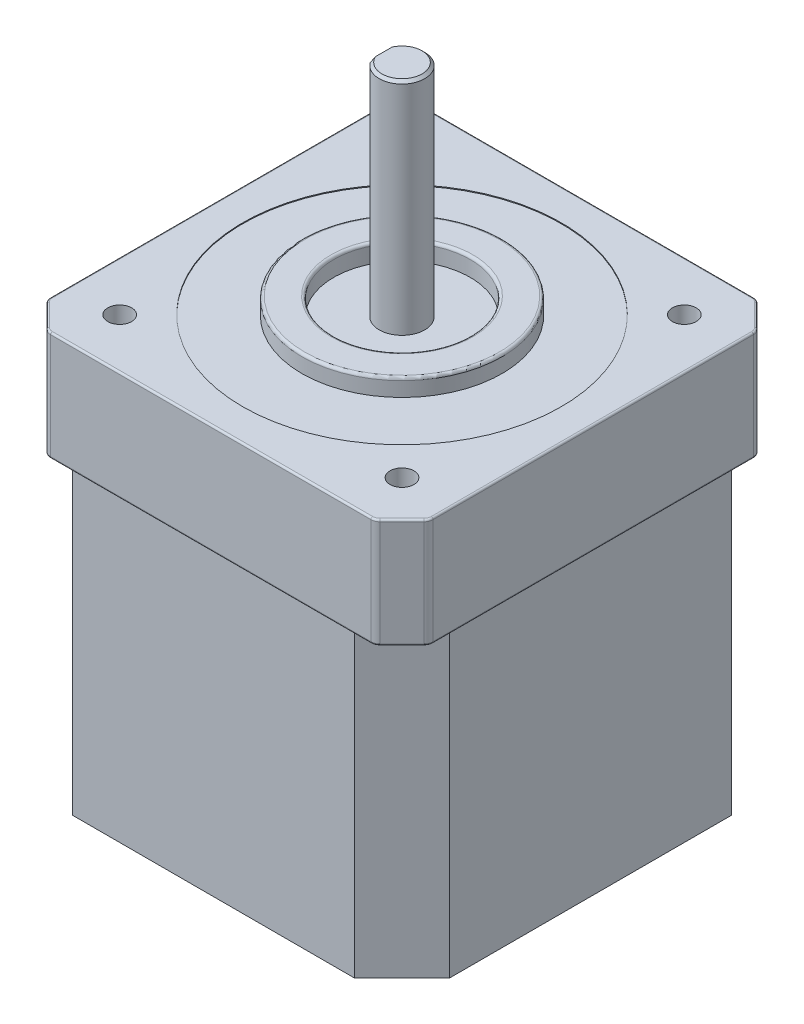
from build123d import *

# Parameters (mm, degrees)
SKETCH_1_W               = 42
SKETCH_1_H               = 42
EXTRUDE_1_DEPTH          = 60
CHAMFER_3_SIZE           = 3
SKETCH_2_R               = 11
EXTRUDE_2_DEPTH          = 1.8
SKETCH_3_R               = 2.5
EXTRUDE_3_DEPTH          = 24
SKETCH_4_OUTSIDE_W       = 64.576
SKETCH_4_OUTSIDE_H       = 64.576
CUT_EXTRUDE_1_DEPTH      = 36
FILLET_2_R               = 1
FILLET_3_R               = 0.2
CUT_EXTRUDE_START        = -15
CUT_EXTRUDE_5_DEPTH      = 15
CHAMFER_5_SIZE           = 0.3
CHAMFER_4_SIZE           = 0.5
SKETCH_6_R               = 1.3105
CUT_EXTRUDE_2_DEPTH      = 4.5
CUT_EXTRUDE_START_2      = -2
SKETCH_7_R               = 7.5
SKETCH_7_R_2             = 2.5
CUT_EXTRUDE_3_DEPTH      = 2
SKETCH_8_R               = 4.125
EXTRUDE_5_DEPTH          = 1.2
SKETCH_9_R               = 2.25
SKETCH_9_R_2             = 2.05
EXTRUDE_6_DEPTH          = 15.4
SKETCH_10_R              = 0.65
EXTRUDE_8_DEPTH          = 15.4
CUT_EXTRUDE_START_3      = -0.1
SKETCH_15_R              = 17.5
SKETCH_15_R_2            = 11
CUT_EXTRUDE_6_DEPTH      = 0.1
FILLET_4_R               = 0.3
PATTERN_CIRCULAR_3_COUNT = 4
SKETCH_20_W              = 88.292571494
SKETCH_20_H              = 79.893843274
CUT_EXTRUDE_13_DEPTH     = 15


with BuildPart() as part:
    # 草图1 → 凸台-拉伸1 (new body)
    with BuildSketch(Plane(origin=(0, 0, 0), x_dir=(1, 0, 0), z_dir=(0, 1, 0))):
        Rectangle(SKETCH_1_W, SKETCH_1_H)
    extrude(amount=EXTRUDE_1_DEPTH)

    # 倒角3
    chamfer_3_edges = [part.edges().sort_by_distance(p)[0] for p in [
        (-21, 30, -21),
        (21, 30, -21),
        (21, 30, 21),
        (-21, 30, 21),
    ]]
    chamfer(chamfer_3_edges, length=CHAMFER_3_SIZE)

    # 草图2 → 凸台-拉伸2 (add)
    with BuildSketch(Plane(origin=(0, 60, 0), x_dir=(1, 0, 0), z_dir=(0, 1, 0))):
        with Locations(Location((0, 0, 0), (0, 0, 270))):
            Circle(SKETCH_2_R)
    extrude(amount=EXTRUDE_2_DEPTH)

    # 草图3 → 凸台-拉伸3 (add)
    with BuildSketch(Plane(origin=(0, 60, 0), x_dir=(1, 0, 0), z_dir=(0, 1, 0))):
        with Locations(Location((0, 0, 0), (0, 0, 270))):
            Circle(SKETCH_3_R)
    extrude(amount=EXTRUDE_3_DEPTH)

    # 草图4 outside → 切除-拉伸1 (cut)
    with BuildSketch(Plane.XZ.offset(-12)):
        Rectangle(SKETCH_4_OUTSIDE_W, SKETCH_4_OUTSIDE_H)
        Polygon((15.471572875, 20.7), (-15.471572875, 20.7), (-20.7, 15.471572875), (-20.7, -15.471572875), (-15.471572875, -20.7), (15.471572875, -20.7), (20.7, -15.471572875), (20.7, 15.471572875), align=None, mode=Mode.SUBTRACT)
    extrude(amount=-CUT_EXTRUDE_1_DEPTH, mode=Mode.SUBTRACT)

    # 圆角2
    fillet_2_edges = [part.edges().sort_by_distance(p)[0] for p in [
        (-18, 6, -21),
        (18, 54, -21),
        (21, 54, 18),
        (21, 6, -18),
        (-18, 54, 21),
        (18, 6, 21),
        (-21, 54, -18),
        (-21, 6, 18),
        (-18, 54, -21),
        (-21, 6, -18),
        (-21, 54, 18),
        (-18, 6, 21),
        (18, 54, 21),
        (21, 6, 18),
        (21, 54, -18),
        (18, 6, -21),
    ]]
    fillet(fillet_2_edges, radius=FILLET_2_R)

    # 圆角3
    fillet_3_edges = [part.edges().sort_by_distance(p)[0] for p in [
        (21, 12, 0),
        (21, 0, 0),
        (0, 0, -21),
        (19.5, 0, -19.5),
        (19.5, 0, 19.5),
        (0, 0, 21),
        (-19.5, 0, 19.5),
        (-21, 0, 0),
        (-19.5, 0, -19.5),
        (-20.923879533, 0, -17.96846987),
        (-17.96846987, 0, -20.923879533),
        (17.96846987, 0, -20.923879533),
        (20.923879533, 0, -17.96846987),
        (-20.923879533, 0, 17.96846987),
        (-17.96846987, 0, 20.923879533),
        (17.96846987, 0, 20.923879533),
        (20.923879533, 0, 17.96846987),
        (19.5, 12, 19.5),
        (19.5, 12, -19.5),
        (0, 12, -21),
        (-19.5, 12, -19.5),
        (-21, 12, 0),
        (-19.5, 12, 19.5),
        (0, 12, 21),
        (-20.923879533, 12, -17.96846987),
        (-17.96846987, 12, -20.923879533),
        (17.96846987, 12, -20.923879533),
        (20.923879533, 12, -17.96846987),
        (-20.923879533, 12, 17.96846987),
        (-17.96846987, 12, 20.923879533),
        (17.96846987, 12, 20.923879533),
        (20.923879533, 12, 17.96846987),
        (0, 48, -21),
        (0, 60, -21),
        (21, 60, 0),
        (19.5, 60, -19.5),
        (-19.5, 60, -19.5),
        (-21, 60, 0),
        (-19.5, 60, 19.5),
        (0, 60, 21),
        (19.5, 60, 19.5),
        (-20.923879533, 60, 17.96846987),
        (-17.96846987, 60, 20.923879533),
        (17.96846987, 60, 20.923879533),
        (20.923879533, 60, 17.96846987),
        (17.96846987, 60, -20.923879533),
        (20.923879533, 60, -17.96846987),
        (-20.923879533, 60, -17.96846987),
        (-17.96846987, 60, -20.923879533),
        (-19.5, 48, -19.5),
        (0, 48, 21),
        (-19.5, 48, 19.5),
        (-21, 48, 0),
        (19.5, 48, -19.5),
        (21, 48, 0),
        (19.5, 48, 19.5),
        (-20.923879533, 48, 17.96846987),
        (-17.96846987, 48, 20.923879533),
        (17.96846987, 48, 20.923879533),
        (20.923879533, 48, 17.96846987),
        (17.96846987, 48, -20.923879533),
        (20.923879533, 48, -17.96846987),
        (-20.923879533, 48, -17.96846987),
        (-17.96846987, 48, -20.923879533),
    ]]
    fillet(fillet_3_edges, radius=FILLET_3_R)

    # 草图14 → 切除-拉伸5 (cut)
    with BuildSketch(Plane(origin=(0, 84, 0), x_dir=(1, 0, 0), z_dir=(0, 1, 0)).offset(CUT_EXTRUDE_START)):
        with BuildLine():
            Line((-2, 1.5), (-2, -1.5))
            ThreePointArc((-2, -1.5), (-2.5, 0), (-2, 1.5))
        make_face()
    extrude(amount=CUT_EXTRUDE_5_DEPTH, mode=Mode.SUBTRACT)

    # 倒角5
    chamfer_5_edges = [part.edges().sort_by_distance(p)[0] for p in [
        (2.236067977, 84, -1.118033989),
    ]]
    chamfer(chamfer_5_edges, length=CHAMFER_5_SIZE)

    # 倒角4
    chamfer_4_edges = [part.edges().sort_by_distance(p)[0] for p in [
        (-2, 69, 0),
    ]]
    chamfer(chamfer_4_edges, length=CHAMFER_4_SIZE - 0.0001)  # a hair under: the kernel refuses the full size

    # 草图6 → 切除-拉伸2 (cut)
    with BuildSketch(Plane(origin=(0, 60, 0), x_dir=(1, 0, 0), z_dir=(0, 1, 0))):
        with Locations(Location((-15.5, 15.5, 0), (0, 0, 270))):
            Circle(SKETCH_6_R)
        with Locations(Location((15.5, 15.5, 0), (0, 0, 90))):
            Circle(SKETCH_6_R)
        with Locations(Location((15.5, -15.5, 0), (0, 0, 270))):
            Circle(SKETCH_6_R)
        with Locations(Location((-15.5, -15.5, 0), (0, 0, 90))):
            Circle(SKETCH_6_R)
    extrude(amount=-CUT_EXTRUDE_2_DEPTH, mode=Mode.SUBTRACT)

    # 草图7 → 切除-拉伸3 (cut)
    with BuildSketch(Plane(origin=(0, 61.8, 0), x_dir=(1, 0, 0), z_dir=(0, 1, 0)).offset(CUT_EXTRUDE_START_2)):
        with Locations(Location((0, 0, 0), (0, 0, 270))):
            Circle(SKETCH_7_R)
        with Locations(Location((0, 0, 0), (0, 0, 143.130102354))):
            Circle(SKETCH_7_R_2, mode=Mode.SUBTRACT)
    extrude(amount=CUT_EXTRUDE_3_DEPTH, mode=Mode.SUBTRACT)

    # 草图8 → 凸台-拉伸5 (add)
    with BuildSketch(Plane(origin=(21, 0, 0), x_dir=(0, 0, -1), z_dir=(1, 0, 0))):
        with Locations(Location((0, 6, 0), (0, 0, 180))):
            Circle(SKETCH_8_R)
    extrude(amount=EXTRUDE_5_DEPTH)

    # 草图9 → 凸台-拉伸6 (add)
    with BuildSketch(Plane(origin=(22.2, 0, 0), x_dir=(0, 0, -1), z_dir=(1, 0, 0))):
        with Locations(Location((0, 6, 0), (0, 0, 180))):
            Circle(SKETCH_9_R)
        with Locations(Location((0, 6, 0), (0, 0, 180))):
            Circle(SKETCH_9_R_2, mode=Mode.SUBTRACT)
    extrude(amount=EXTRUDE_6_DEPTH)

    # 草图10 → 凸台-拉伸8 (add)
    with BuildSketch(Plane(origin=(22.2, 0, 0), x_dir=(0, 0, -1), z_dir=(1, 0, 0))):
        with Locations((0.952627944, 6.55)):
            Circle(SKETCH_10_R)
    extrude_8 = extrude(amount=EXTRUDE_8_DEPTH)

    # 草图15 → 切除-拉伸6 (cut)
    with BuildSketch(Plane(origin=(0, 60, 0), x_dir=(1, 0, 0), z_dir=(0, 1, 0)).offset(CUT_EXTRUDE_START_3)):
        with Locations(Location((0, 0, 0), (0, 0, 270))):
            Circle(SKETCH_15_R)
        with Locations(Location((0, 0, 0), (0, 0, 270))):
            Circle(SKETCH_15_R_2, mode=Mode.SUBTRACT)
    extrude(amount=CUT_EXTRUDE_6_DEPTH, mode=Mode.SUBTRACT)

    # 圆角4
    fillet_4_edges = [part.edges().sort_by_distance(p)[0] for p in [
        (0, 61.8, -11),
        (0, 61.8, -7.5),
    ]]
    fillet(fillet_4_edges, radius=FILLET_4_R)

    # 阵列(圆周)3: 凸台-拉伸8 ×4 about axis
    pattern_circular_3_axis = Axis((0, 6, 0), (1, 0, 0))
    for i in range(1, PATTERN_CIRCULAR_3_COUNT):
        add(extrude_8.rotate(pattern_circular_3_axis, i * 360 / PATTERN_CIRCULAR_3_COUNT))

    # 草图20 → 切除-拉伸13 (cut)
    with BuildSketch(Plane.XZ):
        Rectangle(SKETCH_20_W, SKETCH_20_H)
    extrude(amount=-CUT_EXTRUDE_13_DEPTH, mode=Mode.SUBTRACT)


solid = part.part
